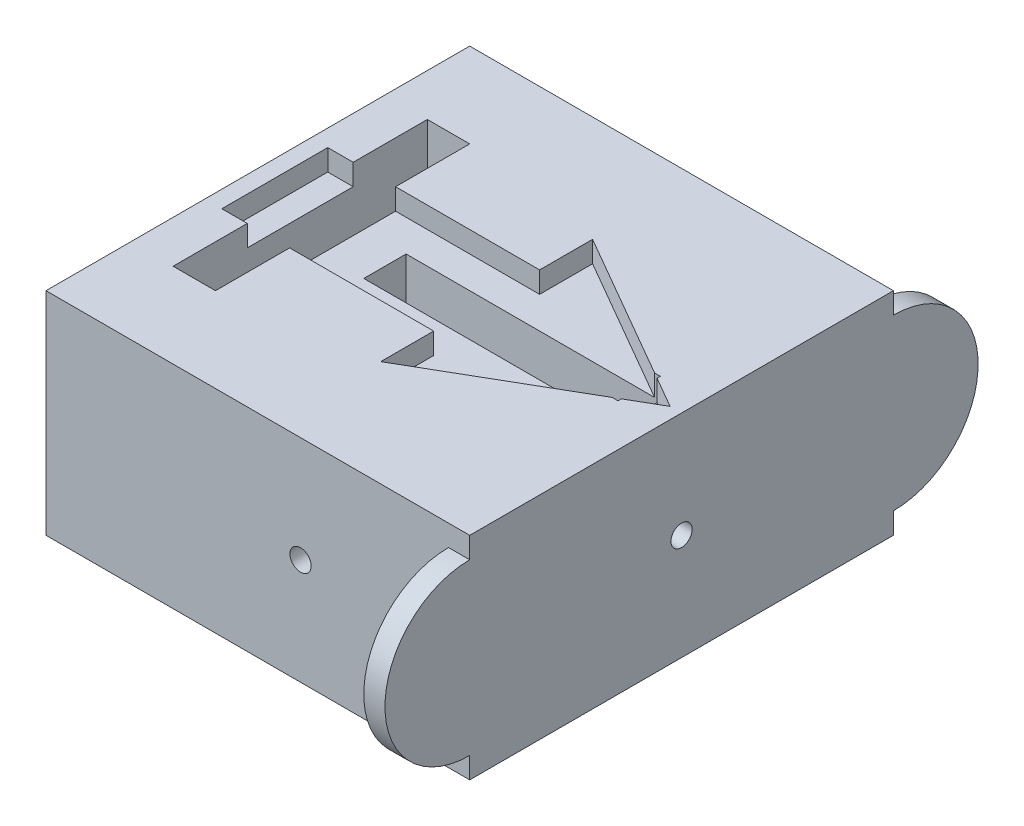
from build123d import *

# Parameters (mm, degrees)
SKETCH1_W           = 200
SKETCH1_H           = 200
BOSS_EXTRUDE2_DEPTH = 100
SKETCH2_R           = 40
BOSS_EXTRUDE3_DEPTH = 10
CUT_EXTRUDE1_DEPTH  = 10
SKETCH4_W           = 120
SKETCH4_H           = 20
SKETCH4_W_2         = 20
SKETCH4_H_2         = 120
CUT_EXTRUDE2_DEPTH  = 199.997487421
SKETCH5_R           = 5
CUT_EXTRUDE3_DEPTH  = 279.567765544
SKETCH6_R           = 5
CUT_EXTRUDE4_DEPTH  = 264.818119165


with BuildPart() as part:
    # Sketch1 → Boss-Extrude2 (new body)
    with BuildSketch(Plane(origin=(0, 0, 0), x_dir=(1, 0, 0), z_dir=(0, 1, 0))):
        Rectangle(SKETCH1_W, SKETCH1_H)
    extrude(amount=BOSS_EXTRUDE2_DEPTH)

    # Sketch2 → Boss-Extrude3 (add)
    with BuildSketch(Plane.ZY.offset(-100)):
        with Locations((100, 50)):
            Circle(SKETCH2_R)
        with Locations((-100, 50)):
            Circle(SKETCH2_R)
    extrude(amount=BOSS_EXTRUDE3_DEPTH)

    # Sketch3 → Cut-Extrude1 (cut)
    with BuildSketch(Plane(origin=(0, 100, 0), x_dir=(1, 0, 0), z_dir=(0, 1, 0))):
        Polygon((8, 25), (8, 50), (94.602540378, 0), (8, -50), (8, -25), (-92, -25), (-92, 25), align=None)
    extrude(amount=-CUT_EXTRUDE1_DEPTH, mode=Mode.SUBTRACT)

    # Sketch4 → Cut-Extrude2 (cut, through all)
    with BuildSketch(Plane(origin=(0, 100, 0), x_dir=(1, 0, 0), z_dir=(0, 1, 0))):
        with Locations((20, 0)):
            Rectangle(SKETCH4_W, SKETCH4_H)
        with Locations((-70, 0)):
            Rectangle(SKETCH4_W_2, SKETCH4_H_2)
    extrude(amount=-CUT_EXTRUDE2_DEPTH, mode=Mode.SUBTRACT)

    # Sketch5 → Cut-Extrude3 (cut, through all)
    with BuildSketch(Plane.XY.offset(100)):
        with Locations((20.147207668, 50)):
            Circle(SKETCH5_R)
    extrude(amount=-CUT_EXTRUDE3_DEPTH, mode=Mode.SUBTRACT)

    # Sketch6 → Cut-Extrude4 (cut, through all)
    with BuildSketch(Plane.ZY.offset(100)):
        with Locations((0, 50)):
            Circle(SKETCH6_R)
    extrude(amount=-CUT_EXTRUDE4_DEPTH, mode=Mode.SUBTRACT)


solid = part.part
